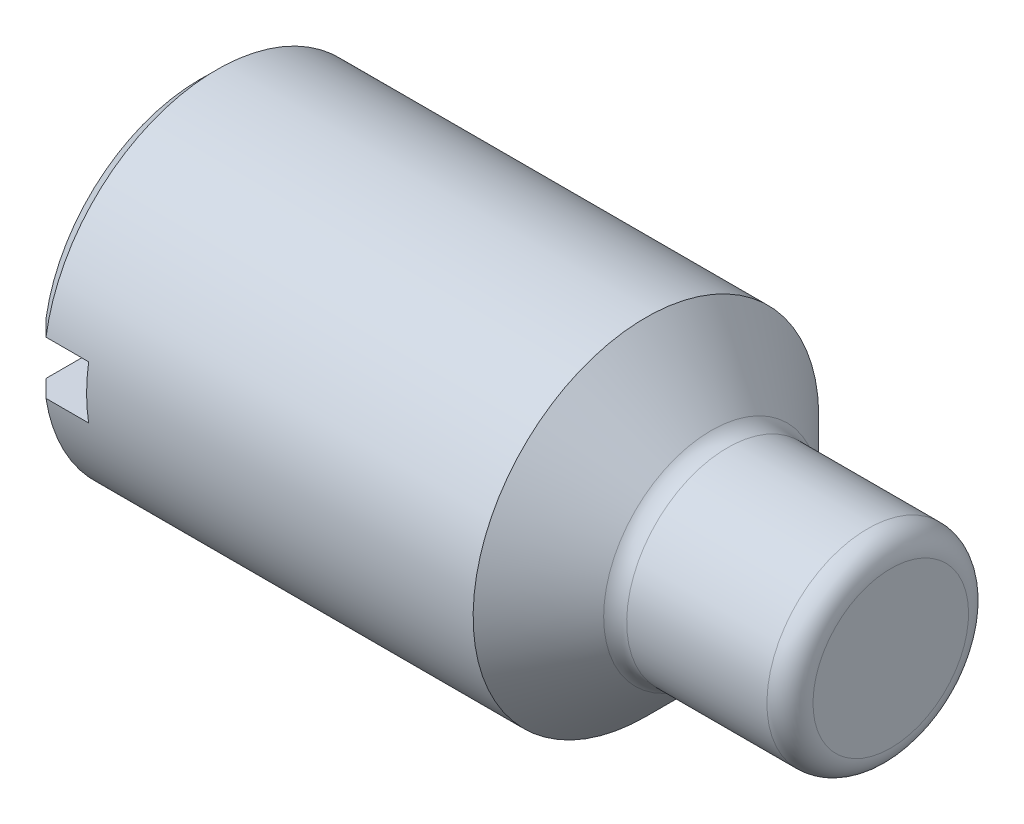
from build123d import *

# Parameters (mm, degrees)
NOTCH_DEPTH      = 7.363961031
NOTCH_DEPTH_BACK = 7.363961031
SKETCH2_W        = 0.52
SKETCH2_H        = 0.46
FILLET1_R        = 0.2
CHAMFER1_SIZE    = 0.15


with BuildPart() as part:
    # Sketch1 → Base (revolve)
    with BuildSketch(Plane.XY):
        Polygon((6, 0), (0, 0), (0, 1.5), (3.875, 1.5), (4.5, 0.875), (6, 0.875), align=None)
    revolve(axis=Axis((-8.57033571, 0, 0), (1, 0, 0)))

    # Sketch2 → Notch (cut, two sides: drawn at the far end of the back side and taken through both)
    with BuildSketch(Plane.XY.offset(-NOTCH_DEPTH_BACK)):
        with Locations((0.26, 0)):
            Rectangle(SKETCH2_W, SKETCH2_H)
    extrude(amount=NOTCH_DEPTH + NOTCH_DEPTH_BACK, mode=Mode.SUBTRACT)

    # Fillet1
    fillet1_edges = [part.edges().sort_by_distance(p)[0] for p in [
        (6, -0.875, 0),
        (4.5, -0.875, 0),
    ]]
    fillet(fillet1_edges, radius=FILLET1_R)

    # Chamfer1
    chamfer1_edges = [part.edges().sort_by_distance(p)[0] for p in [
        (0, 1.139078575, -0.975961065),
        (0, -1.5, 0),
    ]]
    chamfer(chamfer1_edges, length=CHAMFER1_SIZE)


solid = part.part
